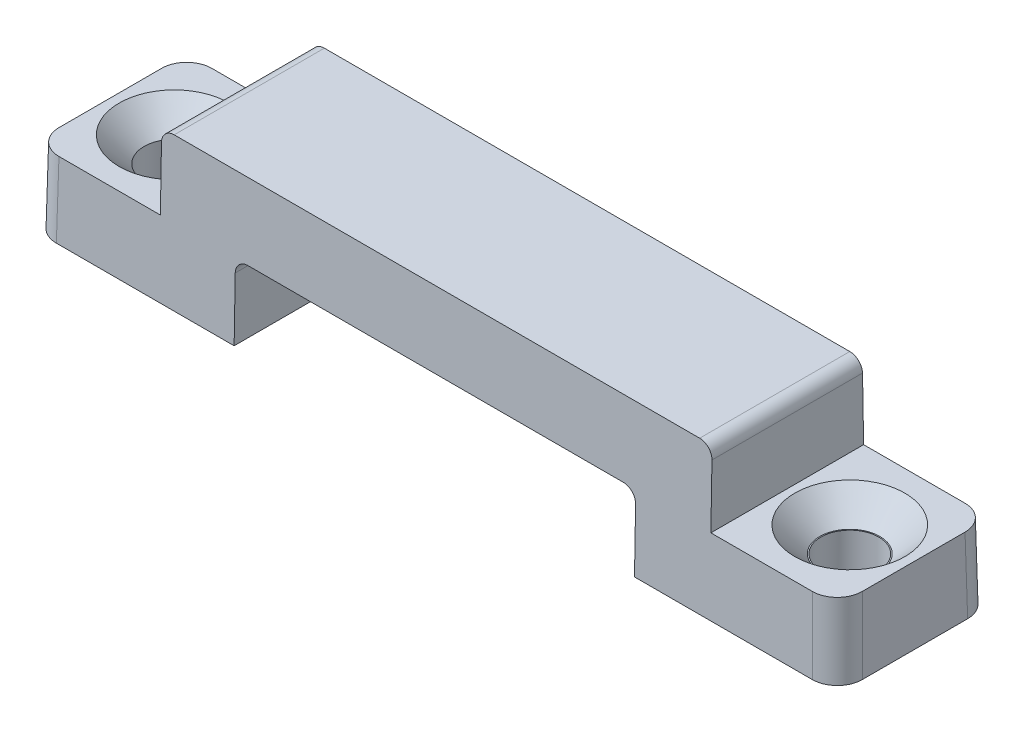
from build123d import *

# Parameters (mm, degrees)
SALIENTE_EXTRUIR1_DEPTH      = 3
TALADROAVANZADO1_OUTLINE_R   = 1.2
TALADROAVANZADO1_DEPTH       = 1
TALADROAVANZADO1_DRAFT       = -45
TALADROAVANZADO1_2_OUTLINE_R = 1.2
TALADROAVANZADO1_2_DEPTH     = 1
TALADROAVANZADO1_2_DRAFT     = -45
CORTAR_EXTRUIR1_REACH        = 18.763
CROQUIS3_R                   = 1.243399974
CROQUIS3_R_2                 = 1.156671482
REDONDEO1_R                  = 0.5
REDONDEO2_R                  = 0.5
NGULO_DE_SALIDA1_ANGLE       = 1
REDONDEO3_R                  = 1


# Read off the part's stored shape, not the designer's step: TaladroAvanzado1
with BuildPart() as part:
    # Croquis1 → Saliente-Extruir1 (new, symmetric)
    with BuildSketch(Plane.XY):
        Polygon((-11, 0), (-8, 0), (-8, 3), (8, 3), (8, 0), (11, 0), (16, 0), (16, 3), (11, 3), (11, 6), (-11, 6), (-11, 3), (-16, 3), (-16, 0), align=None)
    extrude(amount=SALIENTE_EXTRUIR1_DEPTH, both=True)


with BuildPart() as taladroavanzado1_tool:
    # TaladroAvanzado1 outline → TaladroAvanzado1 (with draft: the straight prism first)
    with BuildSketch(Plane(origin=(0, 2, 0), x_dir=(1, 0, 0), z_dir=(0, 1, 0))):
        with Locations((13.5, 0)):
            Circle(TALADROAVANZADO1_OUTLINE_R)
    extrude(amount=TALADROAVANZADO1_DEPTH)
    # TaladroAvanzado1: the draft: its side faces are tilted about the plane it starts from
    taladroavanzado1_sides = [taladroavanzado1_tool.faces().sort_by_distance(p)[0] for p in [
        (12.3, 2.5, 0),
    ]]
    draft(taladroavanzado1_sides, Plane(origin=(0, 2, 0), x_dir=(1, 0, 0), z_dir=(0, 1, 0)), TALADROAVANZADO1_DRAFT)


with BuildPart() as part_1:
    add(part.part)

    # TaladroAvanzado1: cut by taladroavanzado1_tool
    add(taladroavanzado1_tool.part, mode=Mode.SUBTRACT)


with BuildPart() as taladroavanzado1_2_tool:
    # TaladroAvanzado1 2 outline → TaladroAvanzado1 2 (with draft: the straight prism first)
    with BuildSketch(Plane(origin=(0, 2, 0), x_dir=(1, 0, 0), z_dir=(0, 1, 0))):
        with Locations((-13.5, 0)):
            Circle(TALADROAVANZADO1_2_OUTLINE_R)
    extrude(amount=TALADROAVANZADO1_2_DEPTH)
    # TaladroAvanzado1 2: the draft: its side faces are tilted about the plane it starts from
    taladroavanzado1_2_sides = [taladroavanzado1_2_tool.faces().sort_by_distance(p)[0] for p in [
        (-14.7, 2.5, 0),
    ]]
    draft(taladroavanzado1_2_sides, Plane(origin=(0, 2, 0), x_dir=(1, 0, 0), z_dir=(0, 1, 0)), TALADROAVANZADO1_2_DRAFT)


with BuildPart() as part_2:
    add(part_1.part)

    # TaladroAvanzado1 2: cut by taladroavanzado1_2_tool
    add(taladroavanzado1_2_tool.part, mode=Mode.SUBTRACT)

    # Croquis3 → Cortar-Extruir1 (cut, up to next)
    with BuildSketch(Plane(origin=(0, 2, 0), x_dir=(1, 0, 0), z_dir=(0, 1, 0)), mode=Mode.PRIVATE) as cortar_extruir1_sk1:
        with Locations(Location((-13.5, 0, 0), (0, 0, 270))):
            Circle(CROQUIS3_R)
    cortar_extruir1_tool1 = extrude(cortar_extruir1_sk1.sketch, amount=-CORTAR_EXTRUIR1_REACH, mode=Mode.PRIVATE) & part_2.part
    # Croquis3 → Cortar-Extruir1 (cut, up to next)
    with BuildSketch(Plane(origin=(0, 2, 0), x_dir=(1, 0, 0), z_dir=(0, 1, 0)), mode=Mode.PRIVATE) as cortar_extruir1_sk2:
        with Locations(Location((13.5, 0, 0), (0, 0, 270))):
            Circle(CROQUIS3_R_2)
    cortar_extruir1_tool2 = extrude(cortar_extruir1_sk2.sketch, amount=-CORTAR_EXTRUIR1_REACH, mode=Mode.PRIVATE) & part_2.part
    add(cortar_extruir1_tool1.solids().sort_by_distance((-13.5, 2, 0))[0], mode=Mode.SUBTRACT)
    add(cortar_extruir1_tool2.solids().sort_by_distance((13.5, 2, 0))[0], mode=Mode.SUBTRACT)

    # Redondeo1
    redondeo1_edges = [part_2.edges().sort_by_distance(p)[0] for p in [
        (8, 3, 0),
        (-8, 3, 0),
    ]]
    fillet(redondeo1_edges, radius=REDONDEO1_R)

    # Redondeo2
    redondeo2_edges = [part_2.edges().sort_by_distance(p)[0] for p in [
        (-11, 6, 0),
        (11, 6, 0),
    ]]
    fillet(redondeo2_edges, radius=REDONDEO2_R)

    # Ángulo de salida1
    ngulo_de_salida1_faces = [part_2.faces().sort_by_distance(p)[0] for p in [
        (0, 3.234018397, 3),
        (0, 3.234018397, -3),
        (16, 1.5, 0),
        (-16, 1.5, 0),
    ]]
    draft(ngulo_de_salida1_faces, Plane(origin=(11, 6, 3), x_dir=(0, 0, 1), z_dir=(0, 1, 0)), NGULO_DE_SALIDA1_ANGLE)

    # Redondeo3
    redondeo3_edges = [part_2.edges().sort_by_distance(p)[0] for p in [
        (-16.078547792, 1.5, -3.078547792),
        (16.078547792, 1.5, -3.078547792),
        (16.078547792, 1.5, 3.078547792),
        (-16.078547792, 1.5, 3.078547792),
    ]]
    fillet(redondeo3_edges, radius=REDONDEO3_R)


solid = part_2.part
